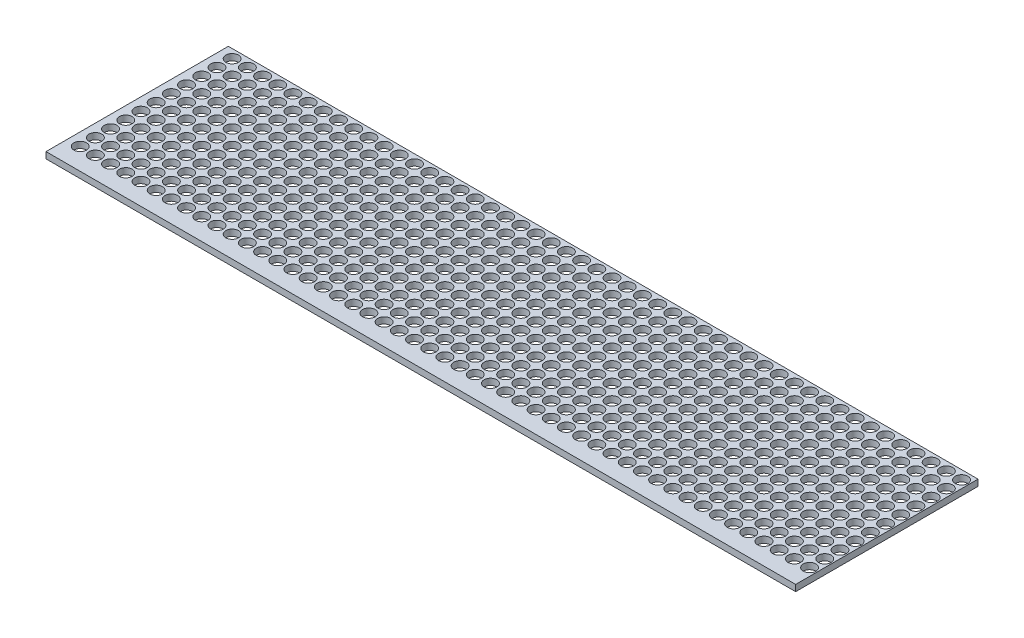
from build123d import *

# Parameters (mm, degrees)
SKETCH1_W           = 592
SKETCH1_H           = 144
BOSS_EXTRUDE1_DEPTH = 5
SKETCH2_R           = 5
CUT_EXTRUDE1_DEPTH  = 5


with BuildPart() as part:
    # Sketch1 → Boss-Extrude1 (new body)
    with BuildSketch(Plane(origin=(0, 0, 0), x_dir=(1, 0, 0), z_dir=(0, 1, 0))):
        Rectangle(SKETCH1_W, SKETCH1_H)
    extrude(amount=BOSS_EXTRUDE1_DEPTH)

    # Sketch2 → Cut-Extrude1 (cut)
    with BuildSketch(Plane(origin=(0, 5, 0), x_dir=(1, 0, 0), z_dir=(0, 1, 0))):
        with Locations(Location((-286, 65, 0), (0, 0, 270))):
            Circle(SKETCH2_R)
        with Locations(Location((-274, 65, 0), (0, 0, 270))):
            Circle(SKETCH2_R)
        with Locations(Location((-262, 65, 0), (0, 0, 270))):
            Circle(SKETCH2_R)
        with Locations(Location((-250, 65, 0), (0, 0, 270))):
            Circle(SKETCH2_R)
        with Locations(Location((-238, 65, 0), (0, 0, 270))):
            Circle(SKETCH2_R)
        with Locations(Location((-226, 65, 0), (0, 0, 270))):
            Circle(SKETCH2_R)
        with Locations(Location((-214, 65, 0), (0, 0, 270))):
            Circle(SKETCH2_R)
        with Locations(Location((-202, 65, 0), (0, 0, 270))):
            Circle(SKETCH2_R)
        with Locations(Location((-190, 65, 0), (0, 0, 270))):
            Circle(SKETCH2_R)
        with Locations(Location((-178, 65, 0), (0, 0, 270))):
            Circle(SKETCH2_R)
        with Locations(Location((-166, 65, 0), (0, 0, 270))):
            Circle(SKETCH2_R)
        with Locations(Location((-154, 65, 0), (0, 0, 270))):
            Circle(SKETCH2_R)
        with Locations(Location((-142, 65, 0), (0, 0, 270))):
            Circle(SKETCH2_R)
        with Locations(Location((-130, 65, 0), (0, 0, 270))):
            Circle(SKETCH2_R)
        with Locations(Location((-118, 65, 0), (0, 0, 270))):
            Circle(SKETCH2_R)
        with Locations(Location((-106, 65, 0), (0, 0, 270))):
            Circle(SKETCH2_R)
        with Locations(Location((-94, 65, 0), (0, 0, 270))):
            Circle(SKETCH2_R)
        with Locations(Location((-82, 65, 0), (0, 0, 270))):
            Circle(SKETCH2_R)
        with Locations(Location((-70, 65, 0), (0, 0, 270))):
            Circle(SKETCH2_R)
        with Locations(Location((-58, 65, 0), (0, 0, 270))):
            Circle(SKETCH2_R)
        with Locations(Location((-46, 65, 0), (0, 0, 270))):
            Circle(SKETCH2_R)
        with Locations(Location((-34, 65, 0), (0, 0, 270))):
            Circle(SKETCH2_R)
        with Locations(Location((-22, 65, 0), (0, 0, 270))):
            Circle(SKETCH2_R)
        with Locations(Location((-10, 65, 0), (0, 0, 270))):
            Circle(SKETCH2_R)
        with Locations(Location((2, 65, 0), (0, 0, 270))):
            Circle(SKETCH2_R)
        with Locations(Location((14, 65, 0), (0, 0, 270))):
            Circle(SKETCH2_R)
        with Locations(Location((26, 65, 0), (0, 0, 270))):
            Circle(SKETCH2_R)
        with Locations(Location((38, 65, 0), (0, 0, 270))):
            Circle(SKETCH2_R)
        with Locations(Location((50, 65, 0), (0, 0, 270))):
            Circle(SKETCH2_R)
        with Locations(Location((62, 65, 0), (0, 0, 270))):
            Circle(SKETCH2_R)
        with Locations(Location((74, 65, 0), (0, 0, 270))):
            Circle(SKETCH2_R)
        with Locations(Location((86, 65, 0), (0, 0, 270))):
            Circle(SKETCH2_R)
        with Locations(Location((98, 65, 0), (0, 0, 270))):
            Circle(SKETCH2_R)
        with Locations(Location((110, 65, 0), (0, 0, 270))):
            Circle(SKETCH2_R)
        with Locations(Location((122, 65, 0), (0, 0, 270))):
            Circle(SKETCH2_R)
        with Locations(Location((134, 65, 0), (0, 0, 270))):
            Circle(SKETCH2_R)
        with Locations(Location((146, 65, 0), (0, 0, 270))):
            Circle(SKETCH2_R)
        with Locations(Location((158, 65, 0), (0, 0, 270))):
            Circle(SKETCH2_R)
        with Locations(Location((170, 65, 0), (0, 0, 270))):
            Circle(SKETCH2_R)
        with Locations(Location((182, 65, 0), (0, 0, 270))):
            Circle(SKETCH2_R)
        with Locations(Location((194, 65, 0), (0, 0, 270))):
            Circle(SKETCH2_R)
        with Locations(Location((206, 65, 0), (0, 0, 270))):
            Circle(SKETCH2_R)
        with Locations(Location((218, 65, 0), (0, 0, 270))):
            Circle(SKETCH2_R)
        with Locations(Location((230, 65, 0), (0, 0, 270))):
            Circle(SKETCH2_R)
        with Locations(Location((242, 65, 0), (0, 0, 270))):
            Circle(SKETCH2_R)
        with Locations(Location((254, 65, 0), (0, 0, 270))):
            Circle(SKETCH2_R)
        with Locations(Location((266, 65, 0), (0, 0, 270))):
            Circle(SKETCH2_R)
        with Locations(Location((278, 65, 0), (0, 0, 270))):
            Circle(SKETCH2_R)
        with Locations(Location((290, 65, 0), (0, 0, 270))):
            Circle(SKETCH2_R)
        with Locations(Location((-274, 53, 0), (0, 0, 270))):
            Circle(SKETCH2_R)
        with Locations(Location((-262, 53, 0), (0, 0, 270))):
            Circle(SKETCH2_R)
        with Locations(Location((-250, 53, 0), (0, 0, 270))):
            Circle(SKETCH2_R)
        with Locations(Location((-238, 53, 0), (0, 0, 270))):
            Circle(SKETCH2_R)
        with Locations(Location((-226, 53, 0), (0, 0, 270))):
            Circle(SKETCH2_R)
        with Locations(Location((-214, 53, 0), (0, 0, 270))):
            Circle(SKETCH2_R)
        with Locations(Location((-202, 53, 0), (0, 0, 270))):
            Circle(SKETCH2_R)
        with Locations(Location((-190, 53, 0), (0, 0, 270))):
            Circle(SKETCH2_R)
        with Locations(Location((-178, 53, 0), (0, 0, 270))):
            Circle(SKETCH2_R)
        with Locations(Location((-166, 53, 0), (0, 0, 270))):
            Circle(SKETCH2_R)
        with Locations(Location((-154, 53, 0), (0, 0, 270))):
            Circle(SKETCH2_R)
        with Locations(Location((-142, 53, 0), (0, 0, 270))):
            Circle(SKETCH2_R)
        with Locations(Location((-130, 53, 0), (0, 0, 270))):
            Circle(SKETCH2_R)
        with Locations(Location((-118, 53, 0), (0, 0, 270))):
            Circle(SKETCH2_R)
        with Locations(Location((-106, 53, 0), (0, 0, 270))):
            Circle(SKETCH2_R)
        with Locations(Location((-94, 53, 0), (0, 0, 270))):
            Circle(SKETCH2_R)
        with Locations(Location((-82, 53, 0), (0, 0, 270))):
            Circle(SKETCH2_R)
        with Locations(Location((-70, 53, 0), (0, 0, 270))):
            Circle(SKETCH2_R)
        with Locations(Location((-58, 53, 0), (0, 0, 270))):
            Circle(SKETCH2_R)
        with Locations(Location((-46, 53, 0), (0, 0, 270))):
            Circle(SKETCH2_R)
        with Locations(Location((-34, 53, 0), (0, 0, 270))):
            Circle(SKETCH2_R)
        with Locations(Location((-22, 53, 0), (0, 0, 270))):
            Circle(SKETCH2_R)
        with Locations(Location((-10, 53, 0), (0, 0, 270))):
            Circle(SKETCH2_R)
        with Locations(Location((2, 53, 0), (0, 0, 270))):
            Circle(SKETCH2_R)
        with Locations(Location((14, 53, 0), (0, 0, 270))):
            Circle(SKETCH2_R)
        with Locations(Location((26, 53, 0), (0, 0, 270))):
            Circle(SKETCH2_R)
        with Locations(Location((38, 53, 0), (0, 0, 270))):
            Circle(SKETCH2_R)
        with Locations(Location((50, 53, 0), (0, 0, 270))):
            Circle(SKETCH2_R)
        with Locations(Location((62, 53, 0), (0, 0, 270))):
            Circle(SKETCH2_R)
        with Locations(Location((74, 53, 0), (0, 0, 270))):
            Circle(SKETCH2_R)
        with Locations(Location((86, 53, 0), (0, 0, 270))):
            Circle(SKETCH2_R)
        with Locations(Location((98, 53, 0), (0, 0, 270))):
            Circle(SKETCH2_R)
        with Locations(Location((110, 53, 0), (0, 0, 270))):
            Circle(SKETCH2_R)
        with Locations(Location((122, 53, 0), (0, 0, 270))):
            Circle(SKETCH2_R)
        with Locations(Location((134, 53, 0), (0, 0, 270))):
            Circle(SKETCH2_R)
        with Locations(Location((146, 53, 0), (0, 0, 270))):
            Circle(SKETCH2_R)
        with Locations(Location((158, 53, 0), (0, 0, 270))):
            Circle(SKETCH2_R)
        with Locations(Location((170, 53, 0), (0, 0, 270))):
            Circle(SKETCH2_R)
        with Locations(Location((182, 53, 0), (0, 0, 270))):
            Circle(SKETCH2_R)
        with Locations(Location((194, 53, 0), (0, 0, 270))):
            Circle(SKETCH2_R)
        with Locations(Location((206, 53, 0), (0, 0, 270))):
            Circle(SKETCH2_R)
        with Locations(Location((218, 53, 0), (0, 0, 270))):
            Circle(SKETCH2_R)
        with Locations(Location((230, 53, 0), (0, 0, 270))):
            Circle(SKETCH2_R)
        with Locations(Location((242, 53, 0), (0, 0, 270))):
            Circle(SKETCH2_R)
        with Locations(Location((254, 53, 0), (0, 0, 270))):
            Circle(SKETCH2_R)
        with Locations(Location((266, 53, 0), (0, 0, 270))):
            Circle(SKETCH2_R)
        with Locations(Location((278, 53, 0), (0, 0, 270))):
            Circle(SKETCH2_R)
        with Locations(Location((290, 53, 0), (0, 0, 270))):
            Circle(SKETCH2_R)
        with Locations(Location((-274, 41, 0), (0, 0, 270))):
            Circle(SKETCH2_R)
        with Locations(Location((-262, 41, 0), (0, 0, 270))):
            Circle(SKETCH2_R)
        with Locations(Location((-250, 41, 0), (0, 0, 270))):
            Circle(SKETCH2_R)
        with Locations(Location((-238, 41, 0), (0, 0, 270))):
            Circle(SKETCH2_R)
        with Locations(Location((-226, 41, 0), (0, 0, 270))):
            Circle(SKETCH2_R)
        with Locations(Location((-214, 41, 0), (0, 0, 270))):
            Circle(SKETCH2_R)
        with Locations(Location((-202, 41, 0), (0, 0, 270))):
            Circle(SKETCH2_R)
        with Locations(Location((-190, 41, 0), (0, 0, 270))):
            Circle(SKETCH2_R)
        with Locations(Location((-178, 41, 0), (0, 0, 270))):
            Circle(SKETCH2_R)
        with Locations(Location((-166, 41, 0), (0, 0, 270))):
            Circle(SKETCH2_R)
        with Locations(Location((-154, 41, 0), (0, 0, 270))):
            Circle(SKETCH2_R)
        with Locations(Location((-142, 41, 0), (0, 0, 270))):
            Circle(SKETCH2_R)
        with Locations(Location((-130, 41, 0), (0, 0, 270))):
            Circle(SKETCH2_R)
        with Locations(Location((-118, 41, 0), (0, 0, 270))):
            Circle(SKETCH2_R)
        with Locations(Location((-106, 41, 0), (0, 0, 270))):
            Circle(SKETCH2_R)
        with Locations(Location((-94, 41, 0), (0, 0, 270))):
            Circle(SKETCH2_R)
        with Locations(Location((-82, 41, 0), (0, 0, 270))):
            Circle(SKETCH2_R)
        with Locations(Location((-70, 41, 0), (0, 0, 270))):
            Circle(SKETCH2_R)
        with Locations(Location((-58, 41, 0), (0, 0, 270))):
            Circle(SKETCH2_R)
        with Locations(Location((-46, 41, 0), (0, 0, 270))):
            Circle(SKETCH2_R)
        with Locations(Location((-34, 41, 0), (0, 0, 270))):
            Circle(SKETCH2_R)
        with Locations(Location((-22, 41, 0), (0, 0, 270))):
            Circle(SKETCH2_R)
        with Locations(Location((-10, 41, 0), (0, 0, 270))):
            Circle(SKETCH2_R)
        with Locations(Location((2, 41, 0), (0, 0, 270))):
            Circle(SKETCH2_R)
        with Locations(Location((14, 41, 0), (0, 0, 270))):
            Circle(SKETCH2_R)
        with Locations(Location((26, 41, 0), (0, 0, 270))):
            Circle(SKETCH2_R)
        with Locations(Location((38, 41, 0), (0, 0, 270))):
            Circle(SKETCH2_R)
        with Locations(Location((50, 41, 0), (0, 0, 270))):
            Circle(SKETCH2_R)
        with Locations(Location((62, 41, 0), (0, 0, 270))):
            Circle(SKETCH2_R)
        with Locations(Location((74, 41, 0), (0, 0, 270))):
            Circle(SKETCH2_R)
        with Locations(Location((86, 41, 0), (0, 0, 270))):
            Circle(SKETCH2_R)
        with Locations(Location((98, 41, 0), (0, 0, 270))):
            Circle(SKETCH2_R)
        with Locations(Location((110, 41, 0), (0, 0, 270))):
            Circle(SKETCH2_R)
        with Locations(Location((122, 41, 0), (0, 0, 270))):
            Circle(SKETCH2_R)
        with Locations(Location((134, 41, 0), (0, 0, 270))):
            Circle(SKETCH2_R)
        with Locations(Location((146, 41, 0), (0, 0, 270))):
            Circle(SKETCH2_R)
        with Locations(Location((158, 41, 0), (0, 0, 270))):
            Circle(SKETCH2_R)
        with Locations(Location((170, 41, 0), (0, 0, 270))):
            Circle(SKETCH2_R)
        with Locations(Location((182, 41, 0), (0, 0, 270))):
            Circle(SKETCH2_R)
        with Locations(Location((194, 41, 0), (0, 0, 270))):
            Circle(SKETCH2_R)
        with Locations(Location((206, 41, 0), (0, 0, 270))):
            Circle(SKETCH2_R)
        with Locations(Location((218, 41, 0), (0, 0, 270))):
            Circle(SKETCH2_R)
        with Locations(Location((230, 41, 0), (0, 0, 270))):
            Circle(SKETCH2_R)
        with Locations(Location((242, 41, 0), (0, 0, 270))):
            Circle(SKETCH2_R)
        with Locations(Location((254, 41, 0), (0, 0, 270))):
            Circle(SKETCH2_R)
        with Locations(Location((266, 41, 0), (0, 0, 270))):
            Circle(SKETCH2_R)
        with Locations(Location((278, 41, 0), (0, 0, 270))):
            Circle(SKETCH2_R)
        with Locations(Location((290, 41, 0), (0, 0, 270))):
            Circle(SKETCH2_R)
        with Locations(Location((-274, 29, 0), (0, 0, 270))):
            Circle(SKETCH2_R)
        with Locations(Location((-262, 29, 0), (0, 0, 270))):
            Circle(SKETCH2_R)
        with Locations(Location((-250, 29, 0), (0, 0, 270))):
            Circle(SKETCH2_R)
        with Locations(Location((-238, 29, 0), (0, 0, 270))):
            Circle(SKETCH2_R)
        with Locations(Location((-226, 29, 0), (0, 0, 270))):
            Circle(SKETCH2_R)
        with Locations(Location((-214, 29, 0), (0, 0, 270))):
            Circle(SKETCH2_R)
        with Locations(Location((-202, 29, 0), (0, 0, 270))):
            Circle(SKETCH2_R)
        with Locations(Location((-190, 29, 0), (0, 0, 270))):
            Circle(SKETCH2_R)
        with Locations(Location((-178, 29, 0), (0, 0, 270))):
            Circle(SKETCH2_R)
        with Locations(Location((-166, 29, 0), (0, 0, 270))):
            Circle(SKETCH2_R)
        with Locations(Location((-154, 29, 0), (0, 0, 270))):
            Circle(SKETCH2_R)
        with Locations(Location((-142, 29, 0), (0, 0, 270))):
            Circle(SKETCH2_R)
        with Locations(Location((-130, 29, 0), (0, 0, 270))):
            Circle(SKETCH2_R)
        with Locations(Location((-118, 29, 0), (0, 0, 270))):
            Circle(SKETCH2_R)
        with Locations(Location((-106, 29, 0), (0, 0, 270))):
            Circle(SKETCH2_R)
        with Locations(Location((-94, 29, 0), (0, 0, 270))):
            Circle(SKETCH2_R)
        with Locations(Location((-82, 29, 0), (0, 0, 270))):
            Circle(SKETCH2_R)
        with Locations(Location((-70, 29, 0), (0, 0, 270))):
            Circle(SKETCH2_R)
        with Locations(Location((-58, 29, 0), (0, 0, 270))):
            Circle(SKETCH2_R)
        with Locations(Location((-46, 29, 0), (0, 0, 270))):
            Circle(SKETCH2_R)
        with Locations(Location((-34, 29, 0), (0, 0, 270))):
            Circle(SKETCH2_R)
        with Locations(Location((-22, 29, 0), (0, 0, 270))):
            Circle(SKETCH2_R)
        with Locations(Location((-10, 29, 0), (0, 0, 270))):
            Circle(SKETCH2_R)
        with Locations(Location((2, 29, 0), (0, 0, 270))):
            Circle(SKETCH2_R)
        with Locations(Location((14, 29, 0), (0, 0, 270))):
            Circle(SKETCH2_R)
        with Locations(Location((26, 29, 0), (0, 0, 270))):
            Circle(SKETCH2_R)
        with Locations(Location((38, 29, 0), (0, 0, 270))):
            Circle(SKETCH2_R)
        with Locations(Location((50, 29, 0), (0, 0, 270))):
            Circle(SKETCH2_R)
        with Locations(Location((62, 29, 0), (0, 0, 270))):
            Circle(SKETCH2_R)
        with Locations(Location((74, 29, 0), (0, 0, 270))):
            Circle(SKETCH2_R)
        with Locations(Location((86, 29, 0), (0, 0, 270))):
            Circle(SKETCH2_R)
        with Locations(Location((98, 29, 0), (0, 0, 270))):
            Circle(SKETCH2_R)
        with Locations(Location((110, 29, 0), (0, 0, 270))):
            Circle(SKETCH2_R)
        with Locations(Location((122, 29, 0), (0, 0, 270))):
            Circle(SKETCH2_R)
        with Locations(Location((134, 29, 0), (0, 0, 270))):
            Circle(SKETCH2_R)
        with Locations(Location((146, 29, 0), (0, 0, 270))):
            Circle(SKETCH2_R)
        with Locations(Location((158, 29, 0), (0, 0, 270))):
            Circle(SKETCH2_R)
        with Locations(Location((170, 29, 0), (0, 0, 270))):
            Circle(SKETCH2_R)
        with Locations(Location((182, 29, 0), (0, 0, 270))):
            Circle(SKETCH2_R)
        with Locations(Location((194, 29, 0), (0, 0, 270))):
            Circle(SKETCH2_R)
        with Locations(Location((206, 29, 0), (0, 0, 270))):
            Circle(SKETCH2_R)
        with Locations(Location((218, 29, 0), (0, 0, 270))):
            Circle(SKETCH2_R)
        with Locations(Location((230, 29, 0), (0, 0, 270))):
            Circle(SKETCH2_R)
        with Locations(Location((242, 29, 0), (0, 0, 270))):
            Circle(SKETCH2_R)
        with Locations(Location((254, 29, 0), (0, 0, 270))):
            Circle(SKETCH2_R)
        with Locations(Location((266, 29, 0), (0, 0, 270))):
            Circle(SKETCH2_R)
        with Locations(Location((278, 29, 0), (0, 0, 270))):
            Circle(SKETCH2_R)
        with Locations(Location((290, 29, 0), (0, 0, 270))):
            Circle(SKETCH2_R)
        with Locations(Location((-274, 17, 0), (0, 0, 270))):
            Circle(SKETCH2_R)
        with Locations(Location((-262, 17, 0), (0, 0, 270))):
            Circle(SKETCH2_R)
        with Locations(Location((-250, 17, 0), (0, 0, 270))):
            Circle(SKETCH2_R)
        with Locations(Location((-238, 17, 0), (0, 0, 270))):
            Circle(SKETCH2_R)
        with Locations(Location((-226, 17, 0), (0, 0, 270))):
            Circle(SKETCH2_R)
        with Locations(Location((-214, 17, 0), (0, 0, 270))):
            Circle(SKETCH2_R)
        with Locations(Location((-202, 17, 0), (0, 0, 270))):
            Circle(SKETCH2_R)
        with Locations(Location((-190, 17, 0), (0, 0, 270))):
            Circle(SKETCH2_R)
        with Locations(Location((-178, 17, 0), (0, 0, 270))):
            Circle(SKETCH2_R)
        with Locations(Location((-166, 17, 0), (0, 0, 270))):
            Circle(SKETCH2_R)
        with Locations(Location((-154, 17, 0), (0, 0, 270))):
            Circle(SKETCH2_R)
        with Locations(Location((-142, 17, 0), (0, 0, 270))):
            Circle(SKETCH2_R)
        with Locations(Location((-130, 17, 0), (0, 0, 270))):
            Circle(SKETCH2_R)
        with Locations(Location((-118, 17, 0), (0, 0, 270))):
            Circle(SKETCH2_R)
        with Locations(Location((-106, 17, 0), (0, 0, 270))):
            Circle(SKETCH2_R)
        with Locations(Location((-94, 17, 0), (0, 0, 270))):
            Circle(SKETCH2_R)
        with Locations(Location((-82, 17, 0), (0, 0, 270))):
            Circle(SKETCH2_R)
        with Locations(Location((-70, 17, 0), (0, 0, 270))):
            Circle(SKETCH2_R)
        with Locations(Location((-58, 17, 0), (0, 0, 270))):
            Circle(SKETCH2_R)
        with Locations(Location((-46, 17, 0), (0, 0, 270))):
            Circle(SKETCH2_R)
        with Locations(Location((-34, 17, 0), (0, 0, 270))):
            Circle(SKETCH2_R)
        with Locations(Location((-22, 17, 0), (0, 0, 270))):
            Circle(SKETCH2_R)
        with Locations(Location((-10, 17, 0), (0, 0, 270))):
            Circle(SKETCH2_R)
        with Locations(Location((2, 17, 0), (0, 0, 270))):
            Circle(SKETCH2_R)
        with Locations(Location((14, 17, 0), (0, 0, 270))):
            Circle(SKETCH2_R)
        with Locations(Location((26, 17, 0), (0, 0, 270))):
            Circle(SKETCH2_R)
        with Locations(Location((38, 17, 0), (0, 0, 270))):
            Circle(SKETCH2_R)
        with Locations(Location((50, 17, 0), (0, 0, 270))):
            Circle(SKETCH2_R)
        with Locations(Location((62, 17, 0), (0, 0, 270))):
            Circle(SKETCH2_R)
        with Locations(Location((74, 17, 0), (0, 0, 270))):
            Circle(SKETCH2_R)
        with Locations(Location((86, 17, 0), (0, 0, 270))):
            Circle(SKETCH2_R)
        with Locations(Location((98, 17, 0), (0, 0, 270))):
            Circle(SKETCH2_R)
        with Locations(Location((110, 17, 0), (0, 0, 270))):
            Circle(SKETCH2_R)
        with Locations(Location((122, 17, 0), (0, 0, 270))):
            Circle(SKETCH2_R)
        with Locations(Location((134, 17, 0), (0, 0, 270))):
            Circle(SKETCH2_R)
        with Locations(Location((146, 17, 0), (0, 0, 270))):
            Circle(SKETCH2_R)
        with Locations(Location((158, 17, 0), (0, 0, 270))):
            Circle(SKETCH2_R)
        with Locations(Location((170, 17, 0), (0, 0, 270))):
            Circle(SKETCH2_R)
        with Locations(Location((182, 17, 0), (0, 0, 270))):
            Circle(SKETCH2_R)
        with Locations(Location((194, 17, 0), (0, 0, 270))):
            Circle(SKETCH2_R)
        with Locations(Location((206, 17, 0), (0, 0, 270))):
            Circle(SKETCH2_R)
        with Locations(Location((218, 17, 0), (0, 0, 270))):
            Circle(SKETCH2_R)
        with Locations(Location((230, 17, 0), (0, 0, 270))):
            Circle(SKETCH2_R)
        with Locations(Location((242, 17, 0), (0, 0, 270))):
            Circle(SKETCH2_R)
        with Locations(Location((254, 17, 0), (0, 0, 270))):
            Circle(SKETCH2_R)
        with Locations(Location((266, 17, 0), (0, 0, 270))):
            Circle(SKETCH2_R)
        with Locations(Location((278, 17, 0), (0, 0, 270))):
            Circle(SKETCH2_R)
        with Locations(Location((290, 17, 0), (0, 0, 270))):
            Circle(SKETCH2_R)
        with Locations(Location((-274, 5, 0), (0, 0, 270))):
            Circle(SKETCH2_R)
        with Locations(Location((-262, 5, 0), (0, 0, 270))):
            Circle(SKETCH2_R)
        with Locations(Location((-250, 5, 0), (0, 0, 270))):
            Circle(SKETCH2_R)
        with Locations(Location((-238, 5, 0), (0, 0, 270))):
            Circle(SKETCH2_R)
        with Locations(Location((-226, 5, 0), (0, 0, 270))):
            Circle(SKETCH2_R)
        with Locations(Location((-214, 5, 0), (0, 0, 270))):
            Circle(SKETCH2_R)
        with Locations(Location((-202, 5, 0), (0, 0, 270))):
            Circle(SKETCH2_R)
        with Locations(Location((-190, 5, 0), (0, 0, 270))):
            Circle(SKETCH2_R)
        with Locations(Location((-178, 5, 0), (0, 0, 270))):
            Circle(SKETCH2_R)
        with Locations(Location((-166, 5, 0), (0, 0, 270))):
            Circle(SKETCH2_R)
        with Locations(Location((-154, 5, 0), (0, 0, 270))):
            Circle(SKETCH2_R)
        with Locations(Location((-142, 5, 0), (0, 0, 270))):
            Circle(SKETCH2_R)
        with Locations(Location((-130, 5, 0), (0, 0, 270))):
            Circle(SKETCH2_R)
        with Locations(Location((-118, 5, 0), (0, 0, 270))):
            Circle(SKETCH2_R)
        with Locations(Location((-106, 5, 0), (0, 0, 270))):
            Circle(SKETCH2_R)
        with Locations(Location((-94, 5, 0), (0, 0, 270))):
            Circle(SKETCH2_R)
        with Locations(Location((-82, 5, 0), (0, 0, 270))):
            Circle(SKETCH2_R)
        with Locations(Location((-70, 5, 0), (0, 0, 270))):
            Circle(SKETCH2_R)
        with Locations(Location((-58, 5, 0), (0, 0, 270))):
            Circle(SKETCH2_R)
        with Locations(Location((-46, 5, 0), (0, 0, 270))):
            Circle(SKETCH2_R)
        with Locations(Location((-34, 5, 0), (0, 0, 270))):
            Circle(SKETCH2_R)
        with Locations(Location((-22, 5, 0), (0, 0, 270))):
            Circle(SKETCH2_R)
        with Locations(Location((-10, 5, 0), (0, 0, 270))):
            Circle(SKETCH2_R)
        with Locations(Location((2, 5, 0), (0, 0, 270))):
            Circle(SKETCH2_R)
        with Locations(Location((14, 5, 0), (0, 0, 270))):
            Circle(SKETCH2_R)
        with Locations(Location((26, 5, 0), (0, 0, 270))):
            Circle(SKETCH2_R)
        with Locations(Location((38, 5, 0), (0, 0, 270))):
            Circle(SKETCH2_R)
        with Locations(Location((50, 5, 0), (0, 0, 270))):
            Circle(SKETCH2_R)
        with Locations(Location((62, 5, 0), (0, 0, 270))):
            Circle(SKETCH2_R)
        with Locations(Location((74, 5, 0), (0, 0, 270))):
            Circle(SKETCH2_R)
        with Locations(Location((86, 5, 0), (0, 0, 270))):
            Circle(SKETCH2_R)
        with Locations(Location((98, 5, 0), (0, 0, 270))):
            Circle(SKETCH2_R)
        with Locations(Location((110, 5, 0), (0, 0, 270))):
            Circle(SKETCH2_R)
        with Locations(Location((122, 5, 0), (0, 0, 270))):
            Circle(SKETCH2_R)
        with Locations(Location((134, 5, 0), (0, 0, 270))):
            Circle(SKETCH2_R)
        with Locations(Location((146, 5, 0), (0, 0, 270))):
            Circle(SKETCH2_R)
        with Locations(Location((158, 5, 0), (0, 0, 270))):
            Circle(SKETCH2_R)
        with Locations(Location((170, 5, 0), (0, 0, 270))):
            Circle(SKETCH2_R)
        with Locations(Location((182, 5, 0), (0, 0, 270))):
            Circle(SKETCH2_R)
        with Locations(Location((194, 5, 0), (0, 0, 270))):
            Circle(SKETCH2_R)
        with Locations(Location((206, 5, 0), (0, 0, 270))):
            Circle(SKETCH2_R)
        with Locations(Location((218, 5, 0), (0, 0, 270))):
            Circle(SKETCH2_R)
        with Locations(Location((230, 5, 0), (0, 0, 270))):
            Circle(SKETCH2_R)
        with Locations(Location((242, 5, 0), (0, 0, 270))):
            Circle(SKETCH2_R)
        with Locations(Location((254, 5, 0), (0, 0, 270))):
            Circle(SKETCH2_R)
        with Locations(Location((266, 5, 0), (0, 0, 270))):
            Circle(SKETCH2_R)
        with Locations(Location((278, 5, 0), (0, 0, 270))):
            Circle(SKETCH2_R)
        with Locations(Location((290, 5, 0), (0, 0, 270))):
            Circle(SKETCH2_R)
        with Locations(Location((-274, -7, 0), (0, 0, 270))):
            Circle(SKETCH2_R)
        with Locations(Location((-262, -7, 0), (0, 0, 270))):
            Circle(SKETCH2_R)
        with Locations(Location((-250, -7, 0), (0, 0, 270))):
            Circle(SKETCH2_R)
        with Locations(Location((-238, -7, 0), (0, 0, 270))):
            Circle(SKETCH2_R)
        with Locations(Location((-226, -7, 0), (0, 0, 270))):
            Circle(SKETCH2_R)
        with Locations(Location((-214, -7, 0), (0, 0, 270))):
            Circle(SKETCH2_R)
        with Locations(Location((-202, -7, 0), (0, 0, 270))):
            Circle(SKETCH2_R)
        with Locations(Location((-190, -7, 0), (0, 0, 270))):
            Circle(SKETCH2_R)
        with Locations(Location((-178, -7, 0), (0, 0, 270))):
            Circle(SKETCH2_R)
        with Locations(Location((-166, -7, 0), (0, 0, 270))):
            Circle(SKETCH2_R)
        with Locations(Location((-154, -7, 0), (0, 0, 270))):
            Circle(SKETCH2_R)
        with Locations(Location((-142, -7, 0), (0, 0, 270))):
            Circle(SKETCH2_R)
        with Locations(Location((-130, -7, 0), (0, 0, 270))):
            Circle(SKETCH2_R)
        with Locations(Location((-118, -7, 0), (0, 0, 270))):
            Circle(SKETCH2_R)
        with Locations(Location((-106, -7, 0), (0, 0, 270))):
            Circle(SKETCH2_R)
        with Locations(Location((-94, -7, 0), (0, 0, 270))):
            Circle(SKETCH2_R)
        with Locations(Location((-82, -7, 0), (0, 0, 270))):
            Circle(SKETCH2_R)
        with Locations(Location((-70, -7, 0), (0, 0, 270))):
            Circle(SKETCH2_R)
        with Locations(Location((-58, -7, 0), (0, 0, 270))):
            Circle(SKETCH2_R)
        with Locations(Location((-46, -7, 0), (0, 0, 270))):
            Circle(SKETCH2_R)
        with Locations(Location((-34, -7, 0), (0, 0, 270))):
            Circle(SKETCH2_R)
        with Locations(Location((-22, -7, 0), (0, 0, 270))):
            Circle(SKETCH2_R)
        with Locations(Location((-10, -7, 0), (0, 0, 270))):
            Circle(SKETCH2_R)
        with Locations(Location((2, -7, 0), (0, 0, 270))):
            Circle(SKETCH2_R)
        with Locations(Location((14, -7, 0), (0, 0, 270))):
            Circle(SKETCH2_R)
        with Locations(Location((26, -7, 0), (0, 0, 270))):
            Circle(SKETCH2_R)
        with Locations(Location((38, -7, 0), (0, 0, 270))):
            Circle(SKETCH2_R)
        with Locations(Location((50, -7, 0), (0, 0, 270))):
            Circle(SKETCH2_R)
        with Locations(Location((62, -7, 0), (0, 0, 270))):
            Circle(SKETCH2_R)
        with Locations(Location((74, -7, 0), (0, 0, 270))):
            Circle(SKETCH2_R)
        with Locations(Location((86, -7, 0), (0, 0, 270))):
            Circle(SKETCH2_R)
        with Locations(Location((98, -7, 0), (0, 0, 270))):
            Circle(SKETCH2_R)
        with Locations(Location((110, -7, 0), (0, 0, 270))):
            Circle(SKETCH2_R)
        with Locations(Location((122, -7, 0), (0, 0, 270))):
            Circle(SKETCH2_R)
        with Locations(Location((134, -7, 0), (0, 0, 270))):
            Circle(SKETCH2_R)
        with Locations(Location((146, -7, 0), (0, 0, 270))):
            Circle(SKETCH2_R)
        with Locations(Location((158, -7, 0), (0, 0, 270))):
            Circle(SKETCH2_R)
        with Locations(Location((170, -7, 0), (0, 0, 270))):
            Circle(SKETCH2_R)
        with Locations(Location((182, -7, 0), (0, 0, 270))):
            Circle(SKETCH2_R)
        with Locations(Location((194, -7, 0), (0, 0, 270))):
            Circle(SKETCH2_R)
        with Locations(Location((206, -7, 0), (0, 0, 270))):
            Circle(SKETCH2_R)
        with Locations(Location((218, -7, 0), (0, 0, 270))):
            Circle(SKETCH2_R)
        with Locations(Location((230, -7, 0), (0, 0, 270))):
            Circle(SKETCH2_R)
        with Locations(Location((242, -7, 0), (0, 0, 270))):
            Circle(SKETCH2_R)
        with Locations(Location((254, -7, 0), (0, 0, 270))):
            Circle(SKETCH2_R)
        with Locations(Location((266, -7, 0), (0, 0, 270))):
            Circle(SKETCH2_R)
        with Locations(Location((278, -7, 0), (0, 0, 270))):
            Circle(SKETCH2_R)
        with Locations(Location((290, -7, 0), (0, 0, 270))):
            Circle(SKETCH2_R)
        with Locations(Location((-274, -19, 0), (0, 0, 270))):
            Circle(SKETCH2_R)
        with Locations(Location((-262, -19, 0), (0, 0, 270))):
            Circle(SKETCH2_R)
        with Locations(Location((-250, -19, 0), (0, 0, 270))):
            Circle(SKETCH2_R)
        with Locations(Location((-238, -19, 0), (0, 0, 270))):
            Circle(SKETCH2_R)
        with Locations(Location((-226, -19, 0), (0, 0, 270))):
            Circle(SKETCH2_R)
        with Locations(Location((-214, -19, 0), (0, 0, 270))):
            Circle(SKETCH2_R)
        with Locations(Location((-202, -19, 0), (0, 0, 270))):
            Circle(SKETCH2_R)
        with Locations(Location((-190, -19, 0), (0, 0, 270))):
            Circle(SKETCH2_R)
        with Locations(Location((-178, -19, 0), (0, 0, 270))):
            Circle(SKETCH2_R)
        with Locations(Location((-166, -19, 0), (0, 0, 270))):
            Circle(SKETCH2_R)
        with Locations(Location((-154, -19, 0), (0, 0, 270))):
            Circle(SKETCH2_R)
        with Locations(Location((-142, -19, 0), (0, 0, 270))):
            Circle(SKETCH2_R)
        with Locations(Location((-130, -19, 0), (0, 0, 270))):
            Circle(SKETCH2_R)
        with Locations(Location((-118, -19, 0), (0, 0, 270))):
            Circle(SKETCH2_R)
        with Locations(Location((-106, -19, 0), (0, 0, 270))):
            Circle(SKETCH2_R)
        with Locations(Location((-94, -19, 0), (0, 0, 270))):
            Circle(SKETCH2_R)
        with Locations(Location((-82, -19, 0), (0, 0, 270))):
            Circle(SKETCH2_R)
        with Locations(Location((-70, -19, 0), (0, 0, 270))):
            Circle(SKETCH2_R)
        with Locations(Location((-58, -19, 0), (0, 0, 270))):
            Circle(SKETCH2_R)
        with Locations(Location((-46, -19, 0), (0, 0, 270))):
            Circle(SKETCH2_R)
        with Locations(Location((-34, -19, 0), (0, 0, 270))):
            Circle(SKETCH2_R)
        with Locations(Location((-22, -19, 0), (0, 0, 270))):
            Circle(SKETCH2_R)
        with Locations(Location((-10, -19, 0), (0, 0, 270))):
            Circle(SKETCH2_R)
        with Locations(Location((2, -19, 0), (0, 0, 270))):
            Circle(SKETCH2_R)
        with Locations(Location((14, -19, 0), (0, 0, 270))):
            Circle(SKETCH2_R)
        with Locations(Location((26, -19, 0), (0, 0, 270))):
            Circle(SKETCH2_R)
        with Locations(Location((38, -19, 0), (0, 0, 270))):
            Circle(SKETCH2_R)
        with Locations(Location((50, -19, 0), (0, 0, 270))):
            Circle(SKETCH2_R)
        with Locations(Location((62, -19, 0), (0, 0, 270))):
            Circle(SKETCH2_R)
        with Locations(Location((74, -19, 0), (0, 0, 270))):
            Circle(SKETCH2_R)
        with Locations(Location((86, -19, 0), (0, 0, 270))):
            Circle(SKETCH2_R)
        with Locations(Location((98, -19, 0), (0, 0, 270))):
            Circle(SKETCH2_R)
        with Locations(Location((110, -19, 0), (0, 0, 270))):
            Circle(SKETCH2_R)
        with Locations(Location((122, -19, 0), (0, 0, 270))):
            Circle(SKETCH2_R)
        with Locations(Location((134, -19, 0), (0, 0, 270))):
            Circle(SKETCH2_R)
        with Locations(Location((146, -19, 0), (0, 0, 270))):
            Circle(SKETCH2_R)
        with Locations(Location((158, -19, 0), (0, 0, 270))):
            Circle(SKETCH2_R)
        with Locations(Location((170, -19, 0), (0, 0, 270))):
            Circle(SKETCH2_R)
        with Locations(Location((182, -19, 0), (0, 0, 270))):
            Circle(SKETCH2_R)
        with Locations(Location((194, -19, 0), (0, 0, 270))):
            Circle(SKETCH2_R)
        with Locations(Location((206, -19, 0), (0, 0, 270))):
            Circle(SKETCH2_R)
        with Locations(Location((218, -19, 0), (0, 0, 270))):
            Circle(SKETCH2_R)
        with Locations(Location((230, -19, 0), (0, 0, 270))):
            Circle(SKETCH2_R)
        with Locations(Location((242, -19, 0), (0, 0, 270))):
            Circle(SKETCH2_R)
        with Locations(Location((254, -19, 0), (0, 0, 270))):
            Circle(SKETCH2_R)
        with Locations(Location((266, -19, 0), (0, 0, 270))):
            Circle(SKETCH2_R)
        with Locations(Location((278, -19, 0), (0, 0, 270))):
            Circle(SKETCH2_R)
        with Locations(Location((290, -19, 0), (0, 0, 270))):
            Circle(SKETCH2_R)
        with Locations(Location((-274, -31, 0), (0, 0, 270))):
            Circle(SKETCH2_R)
        with Locations(Location((-262, -31, 0), (0, 0, 270))):
            Circle(SKETCH2_R)
        with Locations(Location((-250, -31, 0), (0, 0, 270))):
            Circle(SKETCH2_R)
        with Locations(Location((-238, -31, 0), (0, 0, 270))):
            Circle(SKETCH2_R)
        with Locations(Location((-226, -31, 0), (0, 0, 270))):
            Circle(SKETCH2_R)
        with Locations(Location((-214, -31, 0), (0, 0, 270))):
            Circle(SKETCH2_R)
        with Locations(Location((-202, -31, 0), (0, 0, 270))):
            Circle(SKETCH2_R)
        with Locations(Location((-190, -31, 0), (0, 0, 270))):
            Circle(SKETCH2_R)
        with Locations(Location((-178, -31, 0), (0, 0, 270))):
            Circle(SKETCH2_R)
        with Locations(Location((-166, -31, 0), (0, 0, 270))):
            Circle(SKETCH2_R)
        with Locations(Location((-154, -31, 0), (0, 0, 270))):
            Circle(SKETCH2_R)
        with Locations(Location((-142, -31, 0), (0, 0, 270))):
            Circle(SKETCH2_R)
        with Locations(Location((-130, -31, 0), (0, 0, 270))):
            Circle(SKETCH2_R)
        with Locations(Location((-118, -31, 0), (0, 0, 270))):
            Circle(SKETCH2_R)
        with Locations(Location((-106, -31, 0), (0, 0, 270))):
            Circle(SKETCH2_R)
        with Locations(Location((-94, -31, 0), (0, 0, 270))):
            Circle(SKETCH2_R)
        with Locations(Location((-82, -31, 0), (0, 0, 270))):
            Circle(SKETCH2_R)
        with Locations(Location((-70, -31, 0), (0, 0, 270))):
            Circle(SKETCH2_R)
        with Locations(Location((-58, -31, 0), (0, 0, 270))):
            Circle(SKETCH2_R)
        with Locations(Location((-46, -31, 0), (0, 0, 270))):
            Circle(SKETCH2_R)
        with Locations(Location((-34, -31, 0), (0, 0, 270))):
            Circle(SKETCH2_R)
        with Locations(Location((-22, -31, 0), (0, 0, 270))):
            Circle(SKETCH2_R)
        with Locations(Location((-10, -31, 0), (0, 0, 270))):
            Circle(SKETCH2_R)
        with Locations(Location((2, -31, 0), (0, 0, 270))):
            Circle(SKETCH2_R)
        with Locations(Location((14, -31, 0), (0, 0, 270))):
            Circle(SKETCH2_R)
        with Locations(Location((26, -31, 0), (0, 0, 270))):
            Circle(SKETCH2_R)
        with Locations(Location((38, -31, 0), (0, 0, 270))):
            Circle(SKETCH2_R)
        with Locations(Location((50, -31, 0), (0, 0, 270))):
            Circle(SKETCH2_R)
        with Locations(Location((62, -31, 0), (0, 0, 270))):
            Circle(SKETCH2_R)
        with Locations(Location((74, -31, 0), (0, 0, 270))):
            Circle(SKETCH2_R)
        with Locations(Location((86, -31, 0), (0, 0, 270))):
            Circle(SKETCH2_R)
        with Locations(Location((98, -31, 0), (0, 0, 270))):
            Circle(SKETCH2_R)
        with Locations(Location((110, -31, 0), (0, 0, 270))):
            Circle(SKETCH2_R)
        with Locations(Location((122, -31, 0), (0, 0, 270))):
            Circle(SKETCH2_R)
        with Locations(Location((134, -31, 0), (0, 0, 270))):
            Circle(SKETCH2_R)
        with Locations(Location((146, -31, 0), (0, 0, 270))):
            Circle(SKETCH2_R)
        with Locations(Location((158, -31, 0), (0, 0, 270))):
            Circle(SKETCH2_R)
        with Locations(Location((170, -31, 0), (0, 0, 270))):
            Circle(SKETCH2_R)
        with Locations(Location((182, -31, 0), (0, 0, 270))):
            Circle(SKETCH2_R)
        with Locations(Location((194, -31, 0), (0, 0, 270))):
            Circle(SKETCH2_R)
        with Locations(Location((206, -31, 0), (0, 0, 270))):
            Circle(SKETCH2_R)
        with Locations(Location((218, -31, 0), (0, 0, 270))):
            Circle(SKETCH2_R)
        with Locations(Location((230, -31, 0), (0, 0, 270))):
            Circle(SKETCH2_R)
        with Locations(Location((242, -31, 0), (0, 0, 270))):
            Circle(SKETCH2_R)
        with Locations(Location((254, -31, 0), (0, 0, 270))):
            Circle(SKETCH2_R)
        with Locations(Location((266, -31, 0), (0, 0, 270))):
            Circle(SKETCH2_R)
        with Locations(Location((278, -31, 0), (0, 0, 270))):
            Circle(SKETCH2_R)
        with Locations(Location((290, -31, 0), (0, 0, 270))):
            Circle(SKETCH2_R)
        with Locations(Location((-274, -43, 0), (0, 0, 270))):
            Circle(SKETCH2_R)
        with Locations(Location((-262, -43, 0), (0, 0, 270))):
            Circle(SKETCH2_R)
        with Locations(Location((-250, -43, 0), (0, 0, 270))):
            Circle(SKETCH2_R)
        with Locations(Location((-238, -43, 0), (0, 0, 270))):
            Circle(SKETCH2_R)
        with Locations(Location((-226, -43, 0), (0, 0, 270))):
            Circle(SKETCH2_R)
        with Locations(Location((-214, -43, 0), (0, 0, 270))):
            Circle(SKETCH2_R)
        with Locations(Location((-202, -43, 0), (0, 0, 270))):
            Circle(SKETCH2_R)
        with Locations(Location((-190, -43, 0), (0, 0, 270))):
            Circle(SKETCH2_R)
        with Locations(Location((-178, -43, 0), (0, 0, 270))):
            Circle(SKETCH2_R)
        with Locations(Location((-166, -43, 0), (0, 0, 270))):
            Circle(SKETCH2_R)
        with Locations(Location((-154, -43, 0), (0, 0, 270))):
            Circle(SKETCH2_R)
        with Locations(Location((-142, -43, 0), (0, 0, 270))):
            Circle(SKETCH2_R)
        with Locations(Location((-130, -43, 0), (0, 0, 270))):
            Circle(SKETCH2_R)
        with Locations(Location((-118, -43, 0), (0, 0, 270))):
            Circle(SKETCH2_R)
        with Locations(Location((-106, -43, 0), (0, 0, 270))):
            Circle(SKETCH2_R)
        with Locations(Location((-94, -43, 0), (0, 0, 270))):
            Circle(SKETCH2_R)
        with Locations(Location((-82, -43, 0), (0, 0, 270))):
            Circle(SKETCH2_R)
        with Locations(Location((-70, -43, 0), (0, 0, 270))):
            Circle(SKETCH2_R)
        with Locations(Location((-58, -43, 0), (0, 0, 270))):
            Circle(SKETCH2_R)
        with Locations(Location((-46, -43, 0), (0, 0, 270))):
            Circle(SKETCH2_R)
        with Locations(Location((-34, -43, 0), (0, 0, 270))):
            Circle(SKETCH2_R)
        with Locations(Location((-22, -43, 0), (0, 0, 270))):
            Circle(SKETCH2_R)
        with Locations(Location((-10, -43, 0), (0, 0, 270))):
            Circle(SKETCH2_R)
        with Locations(Location((2, -43, 0), (0, 0, 270))):
            Circle(SKETCH2_R)
        with Locations(Location((14, -43, 0), (0, 0, 270))):
            Circle(SKETCH2_R)
        with Locations(Location((26, -43, 0), (0, 0, 270))):
            Circle(SKETCH2_R)
        with Locations(Location((38, -43, 0), (0, 0, 270))):
            Circle(SKETCH2_R)
        with Locations(Location((50, -43, 0), (0, 0, 270))):
            Circle(SKETCH2_R)
        with Locations(Location((62, -43, 0), (0, 0, 270))):
            Circle(SKETCH2_R)
        with Locations(Location((74, -43, 0), (0, 0, 270))):
            Circle(SKETCH2_R)
        with Locations(Location((86, -43, 0), (0, 0, 270))):
            Circle(SKETCH2_R)
        with Locations(Location((98, -43, 0), (0, 0, 270))):
            Circle(SKETCH2_R)
        with Locations(Location((110, -43, 0), (0, 0, 270))):
            Circle(SKETCH2_R)
        with Locations(Location((122, -43, 0), (0, 0, 270))):
            Circle(SKETCH2_R)
        with Locations(Location((134, -43, 0), (0, 0, 270))):
            Circle(SKETCH2_R)
        with Locations(Location((146, -43, 0), (0, 0, 270))):
            Circle(SKETCH2_R)
        with Locations(Location((158, -43, 0), (0, 0, 270))):
            Circle(SKETCH2_R)
        with Locations(Location((170, -43, 0), (0, 0, 270))):
            Circle(SKETCH2_R)
        with Locations(Location((182, -43, 0), (0, 0, 270))):
            Circle(SKETCH2_R)
        with Locations(Location((194, -43, 0), (0, 0, 270))):
            Circle(SKETCH2_R)
        with Locations(Location((206, -43, 0), (0, 0, 270))):
            Circle(SKETCH2_R)
        with Locations(Location((218, -43, 0), (0, 0, 270))):
            Circle(SKETCH2_R)
        with Locations(Location((230, -43, 0), (0, 0, 270))):
            Circle(SKETCH2_R)
        with Locations(Location((242, -43, 0), (0, 0, 270))):
            Circle(SKETCH2_R)
        with Locations(Location((254, -43, 0), (0, 0, 270))):
            Circle(SKETCH2_R)
        with Locations(Location((266, -43, 0), (0, 0, 270))):
            Circle(SKETCH2_R)
        with Locations(Location((278, -43, 0), (0, 0, 270))):
            Circle(SKETCH2_R)
        with Locations(Location((290, -43, 0), (0, 0, 270))):
            Circle(SKETCH2_R)
        with Locations(Location((-274, -55, 0), (0, 0, 270))):
            Circle(SKETCH2_R)
        with Locations(Location((-262, -55, 0), (0, 0, 270))):
            Circle(SKETCH2_R)
        with Locations(Location((-250, -55, 0), (0, 0, 270))):
            Circle(SKETCH2_R)
        with Locations(Location((-238, -55, 0), (0, 0, 270))):
            Circle(SKETCH2_R)
        with Locations(Location((-226, -55, 0), (0, 0, 270))):
            Circle(SKETCH2_R)
        with Locations(Location((-214, -55, 0), (0, 0, 270))):
            Circle(SKETCH2_R)
        with Locations(Location((-202, -55, 0), (0, 0, 270))):
            Circle(SKETCH2_R)
        with Locations(Location((-190, -55, 0), (0, 0, 270))):
            Circle(SKETCH2_R)
        with Locations(Location((-178, -55, 0), (0, 0, 270))):
            Circle(SKETCH2_R)
        with Locations(Location((-166, -55, 0), (0, 0, 270))):
            Circle(SKETCH2_R)
        with Locations(Location((-154, -55, 0), (0, 0, 270))):
            Circle(SKETCH2_R)
        with Locations(Location((-142, -55, 0), (0, 0, 270))):
            Circle(SKETCH2_R)
        with Locations(Location((-130, -55, 0), (0, 0, 270))):
            Circle(SKETCH2_R)
        with Locations(Location((-118, -55, 0), (0, 0, 270))):
            Circle(SKETCH2_R)
        with Locations(Location((-106, -55, 0), (0, 0, 270))):
            Circle(SKETCH2_R)
        with Locations(Location((-94, -55, 0), (0, 0, 270))):
            Circle(SKETCH2_R)
        with Locations(Location((-82, -55, 0), (0, 0, 270))):
            Circle(SKETCH2_R)
        with Locations(Location((-70, -55, 0), (0, 0, 270))):
            Circle(SKETCH2_R)
        with Locations(Location((-58, -55, 0), (0, 0, 270))):
            Circle(SKETCH2_R)
        with Locations(Location((-46, -55, 0), (0, 0, 270))):
            Circle(SKETCH2_R)
        with Locations(Location((-34, -55, 0), (0, 0, 270))):
            Circle(SKETCH2_R)
        with Locations(Location((-22, -55, 0), (0, 0, 270))):
            Circle(SKETCH2_R)
        with Locations(Location((-10, -55, 0), (0, 0, 270))):
            Circle(SKETCH2_R)
        with Locations(Location((2, -55, 0), (0, 0, 270))):
            Circle(SKETCH2_R)
        with Locations(Location((14, -55, 0), (0, 0, 270))):
            Circle(SKETCH2_R)
        with Locations(Location((26, -55, 0), (0, 0, 270))):
            Circle(SKETCH2_R)
        with Locations(Location((38, -55, 0), (0, 0, 270))):
            Circle(SKETCH2_R)
        with Locations(Location((50, -55, 0), (0, 0, 270))):
            Circle(SKETCH2_R)
        with Locations(Location((62, -55, 0), (0, 0, 270))):
            Circle(SKETCH2_R)
        with Locations(Location((74, -55, 0), (0, 0, 270))):
            Circle(SKETCH2_R)
        with Locations(Location((86, -55, 0), (0, 0, 270))):
            Circle(SKETCH2_R)
        with Locations(Location((98, -55, 0), (0, 0, 270))):
            Circle(SKETCH2_R)
        with Locations(Location((110, -55, 0), (0, 0, 270))):
            Circle(SKETCH2_R)
        with Locations(Location((122, -55, 0), (0, 0, 270))):
            Circle(SKETCH2_R)
        with Locations(Location((134, -55, 0), (0, 0, 270))):
            Circle(SKETCH2_R)
        with Locations(Location((146, -55, 0), (0, 0, 270))):
            Circle(SKETCH2_R)
        with Locations(Location((158, -55, 0), (0, 0, 270))):
            Circle(SKETCH2_R)
        with Locations(Location((170, -55, 0), (0, 0, 270))):
            Circle(SKETCH2_R)
        with Locations(Location((182, -55, 0), (0, 0, 270))):
            Circle(SKETCH2_R)
        with Locations(Location((194, -55, 0), (0, 0, 270))):
            Circle(SKETCH2_R)
        with Locations(Location((206, -55, 0), (0, 0, 270))):
            Circle(SKETCH2_R)
        with Locations(Location((218, -55, 0), (0, 0, 270))):
            Circle(SKETCH2_R)
        with Locations(Location((230, -55, 0), (0, 0, 270))):
            Circle(SKETCH2_R)
        with Locations(Location((242, -55, 0), (0, 0, 270))):
            Circle(SKETCH2_R)
        with Locations(Location((254, -55, 0), (0, 0, 270))):
            Circle(SKETCH2_R)
        with Locations(Location((266, -55, 0), (0, 0, 270))):
            Circle(SKETCH2_R)
        with Locations(Location((278, -55, 0), (0, 0, 270))):
            Circle(SKETCH2_R)
        with Locations(Location((290, -55, 0), (0, 0, 270))):
            Circle(SKETCH2_R)
        with Locations(Location((-286, 53, 0), (0, 0, 270))):
            Circle(SKETCH2_R)
        with Locations(Location((-286, 41, 0), (0, 0, 270))):
            Circle(SKETCH2_R)
        with Locations(Location((-286, 29, 0), (0, 0, 270))):
            Circle(SKETCH2_R)
        with Locations(Location((-286, 17, 0), (0, 0, 270))):
            Circle(SKETCH2_R)
        with Locations(Location((-286, 5, 0), (0, 0, 270))):
            Circle(SKETCH2_R)
        with Locations(Location((-286, -7, 0), (0, 0, 270))):
            Circle(SKETCH2_R)
        with Locations(Location((-286, -19, 0), (0, 0, 270))):
            Circle(SKETCH2_R)
        with Locations(Location((-286, -31, 0), (0, 0, 270))):
            Circle(SKETCH2_R)
        with Locations(Location((-286, -43, 0), (0, 0, 270))):
            Circle(SKETCH2_R)
        with Locations(Location((-286, -55, 0), (0, 0, 270))):
            Circle(SKETCH2_R)
    extrude(amount=-CUT_EXTRUDE1_DEPTH, mode=Mode.SUBTRACT)


solid = part.part
